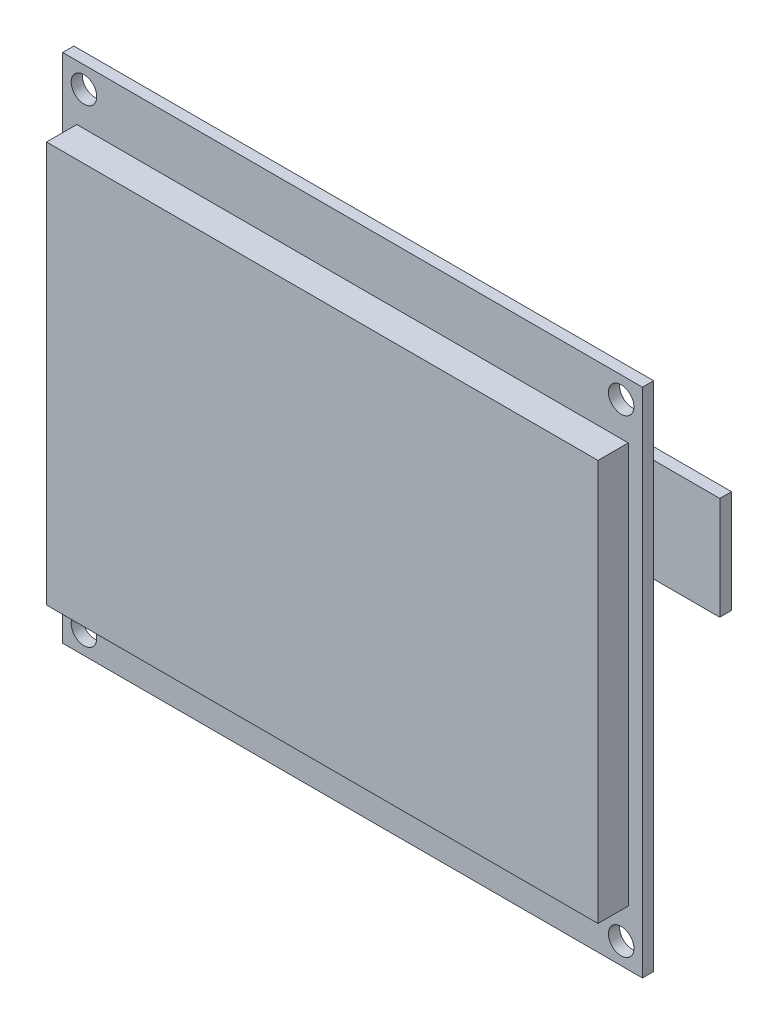
from build123d import *

# Parameters (mm, degrees)
SKETCH1_W           = 81.6864
SKETCH1_H           = 72.0852
BOSS_EXTRUDE1_DEPTH = 1.5748
SKETCH2_W           = 77.7
SKETCH2_H           = 56.5
BOSS_EXTRUDE2_DEPTH = 4.27
SKETCH3_W           = 30
SKETCH3_H           = 14.5
BOSS_EXTRUDE3_DEPTH = 1.65
SKETCH4_R           = 1.8
CUT_EXTRUDE1_DEPTH  = 60.915385303


with BuildPart() as part:
    # Sketch1 → Boss-Extrude1 (new body)
    with BuildSketch(Plane(origin=(0, 0, 0), x_dir=(-1, 0, 0), z_dir=(0, 0, -1))):
        with Locations((2.85, -0.25)):
            Rectangle(SKETCH1_W, SKETCH1_H)
    extrude(amount=BOSS_EXTRUDE1_DEPTH)

    # Sketch2 → Boss-Extrude2 (add)
    with BuildSketch(Plane(origin=(0, 0, 0), x_dir=(-1, 0, 0), z_dir=(0, 0, -1))):
        with Locations((2.85, -0.25)):
            Rectangle(SKETCH2_W, SKETCH2_H)
    extrude(amount=-BOSS_EXTRUDE2_DEPTH)

    # Sketch3 → Boss-Extrude3 (add)
    with BuildSketch(Plane.XY.offset(-1.5748)):
        with Locations((32.3132, 18.844065038)):
            Rectangle(SKETCH3_W, SKETCH3_H)
    extrude(amount=-BOSS_EXTRUDE3_DEPTH)

    # Sketch4 → Cut-Extrude1 (cut, through all)
    with BuildSketch(Plane(origin=(0, 0, -1.5748), x_dir=(-1, 0, 0), z_dir=(0, 0, -1))):
        with Locations((40.6932, 32.7926)):
            Circle(SKETCH4_R)
        with Locations((40.6932, -33.2926)):
            Circle(SKETCH4_R)
        with Locations((-34.9932, -33.2926)):
            Circle(SKETCH4_R)
        with Locations((-34.9932, 32.7926)):
            Circle(SKETCH4_R)
    extrude(amount=-CUT_EXTRUDE1_DEPTH, mode=Mode.SUBTRACT)


solid = part.part
